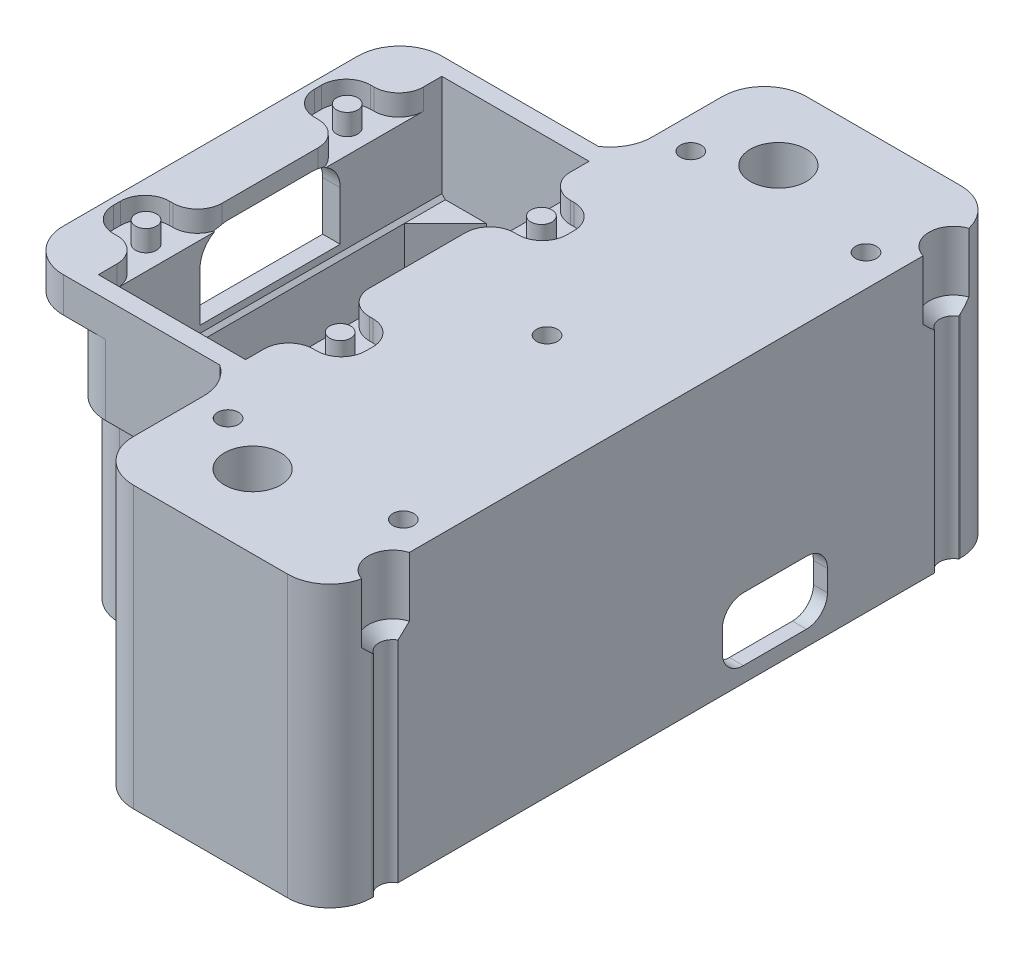
from build123d import *

# Parameters (mm, degrees)
SZKIC1_W                     = 24
SZKIC1_H                     = 52
DODANIE_WYCI_GNI_CIE1_DEPTH  = 25
SZKIC2_W                     = 26
SZKIC2_H                     = 54
SZKIC2_W_2                   = 21
SZKIC2_H_2                   = 49
DODANIE_WYCI_GNI_CIE2_DEPTH  = 12
SZKIC3_W                     = 38
SZKIC3_H                     = 54
SZKIC3_W_2                   = 21
SZKIC3_H_2                   = 49
DODANIE_WYCI_GNI_CIE3_DEPTH  = 2
SZKIC4_W                     = 38
SZKIC4_H                     = 54
DODANIE_WYCI_GNI_CIE4_DEPTH  = 3
ZAOKR_GLENIE1_R              = 3.5
SZKIC5_R                     = 1.5
DODANIE_WYCI_GNI_CIE9_DEPTH  = 3
WYTNIJ_WYCI_GNI_CIE2_REACH   = 63.425
SZKIC7_W                     = 20
SZKIC7_H                     = 11
SZKIC8_W                     = 34
SZKIC8_H                     = 96
SZKIC8_W_2                   = 30
SZKIC8_H_2                   = 92
DODANIE_WYCI_GNI_CIE5_DEPTH  = 18.5
SZKIC9_W                     = 34
SZKIC9_H                     = 96
DODANIE_WYCI_GNI_CIE6_DEPTH  = 3
SZKIC10_R                    = 1.9
WYTNIJ_WYCI_GNI_CIE3_DEPTH   = 70.873099259
ZAOKR_GLENIE2_R              = 4
SZKIC11_W                    = 34
SZKIC11_H                    = 96
SZKIC11_R                    = 4
DODANIE_WYCI_GNI_CIE7_DEPTH  = 3.5
SZKIC20_R                    = 4
DODANIE_WYCI_GNI_CIE10_DEPTH = 10
SZKIC21_R                    = 4
DODANIE_WYCI_GNI_CIE11_DEPTH = 5
SZKIC13_R                    = 1.5
WYTNIJ_WYCI_GNI_CIE4_DEPTH   = 6
WYTNIJ_WYCI_GNI_CIE5_DEPTH   = 72.028163428
SFAZOWANIE1_SIZE             = 0.5
SFAZOWANIE2_SIZE             = 2.1
ZAOKR_GLENIE3_R              = 6
ZAOKR_GLENIE4_R              = 4
SZKIC18_R                    = 3.5
WYTNIJ_WYCI_GNI_CIE8_DEPTH   = 10
SFAZOWANIE3_SIZE             = 1.5
SZKIC19_R                    = 2
WYTNIJ_WYCI_GNI_CIE9_DEPTH   = 73.938330286
WYTNIJ_WYCI_GNI_CIE10_REACH  = 92.161
SZKIC22_W                    = 15
SZKIC22_H                    = 9
ZAOKR_GLENIE5_R              = 3


with BuildPart() as part:
    # Szkic1 → Dodanie-wyciągnięcie1 (new body)
    with BuildSketch(Plane(origin=(0, 0, 0), x_dir=(1, 0, 0), z_dir=(0, 1, 0))):
        Rectangle(SZKIC1_W, SZKIC1_H)
        with BuildLine():
            Line((10, 14.5), (10, -14.5))
            ThreePointArc((10, -14.5), (0, -24.5), (-10, -14.5))
            Line((-10, -14.5), (-10, 14.5))
            ThreePointArc((-10, 14.5), (0, 24.5), (10, 14.5))
        make_face(mode=Mode.SUBTRACT)
    extrude(amount=DODANIE_WYCI_GNI_CIE1_DEPTH)

    # Szkic2 → Dodanie-wyciągnięcie2 (add)
    with BuildSketch(Plane(origin=(0, 25, 0), x_dir=(1, 0, 0), z_dir=(0, 1, 0))):
        Rectangle(SZKIC2_W, SZKIC2_H)
        Rectangle(SZKIC2_W_2, SZKIC2_H_2, mode=Mode.SUBTRACT)
    extrude(amount=DODANIE_WYCI_GNI_CIE2_DEPTH)

    # Szkic3 → Dodanie-wyciągnięcie3 (add)
    with BuildSketch(Plane(origin=(0, 37, 0), x_dir=(1, 0, 0), z_dir=(0, 1, 0))):
        Rectangle(SZKIC3_W, SZKIC3_H)
        Rectangle(SZKIC3_W_2, SZKIC3_H_2, mode=Mode.SUBTRACT)
    extrude(amount=-DODANIE_WYCI_GNI_CIE3_DEPTH)

    # Szkic4 → Dodanie-wyciągnięcie4 (add)
    with BuildSketch(Plane(origin=(0, 37, 0), x_dir=(1, 0, 0), z_dir=(0, 1, 0))):
        Rectangle(SZKIC4_W, SZKIC4_H)
        Polygon((-10, 24.5), (10, 24.5), (10.5, 24.5), (10.5, 18.35), (18, 18.35), (18, 10.35), (10.5, 10.35), (10.5, -10.35), (18, -10.35), (18, -18.35), (10.5, -18.35), (10.5, -24.5), (10, -24.5), (-10, -24.5), (-10.5, -24.5), (-10.5, -18.35), (-18, -18.35), (-18, -10.35), (-10.5, -10.35), (-10.5, 10.35), (-18, 10.35), (-18, 18.35), (-10.5, 18.35), (-10.5, 24.5), align=None, mode=Mode.SUBTRACT)
    extrude(amount=DODANIE_WYCI_GNI_CIE4_DEPTH)

    # Zaokrąglenie1
    zaokr_glenie1_edges = [part.edges().sort_by_distance(p)[0] for p in [
        (10.5, 38.5, -18.35),
        (18, 38.5, -18.35),
        (18, 38.5, -10.35),
        (10.5, 38.5, -10.35),
        (10.5, 38.5, 10.35),
        (18, 38.5, 10.35),
        (18, 38.5, 18.35),
        (10.5, 38.5, 18.35),
        (-10.5, 38.5, 18.35),
        (-18, 38.5, 18.35),
        (-18, 38.5, 10.35),
        (-10.5, 38.5, 10.35),
        (-10.5, 38.5, -10.35),
        (-18, 38.5, -10.35),
        (-18, 38.5, -18.35),
        (-10.5, 38.5, -18.35),
    ]]
    fillet(zaokr_glenie1_edges, radius=ZAOKR_GLENIE1_R)

    # Szkic5 → Dodanie-wyciągnięcie9 (add)
    with BuildSketch(Plane(origin=(0, 37, 0), x_dir=(1, 0, 0), z_dir=(0, 1, 0))):
        with Locations(Location((13.85, -14.35, 0), (0, 0, 270))):
            Circle(SZKIC5_R)
        with Locations(Location((13.85, 14.35, 0), (0, 0, 270))):
            Circle(SZKIC5_R)
        with Locations(Location((-13.85, -14.35, 0), (0, 0, 90))):
            Circle(SZKIC5_R)
        with Locations(Location((-13.85, 14.35, 0), (0, 0, 90))):
            Circle(SZKIC5_R)
    extrude(amount=DODANIE_WYCI_GNI_CIE9_DEPTH)

    # Szkic7 → Wytnij-wyciągnięcie2 (cut, up to next)
    with BuildSketch(Plane.ZY.offset(19), mode=Mode.PRIVATE) as wytnij_wyci_gni_cie2_sk1:
        with Locations((0, 32)):
            Rectangle(SZKIC7_W, SZKIC7_H)
    wytnij_wyci_gni_cie2_tool1 = extrude(wytnij_wyci_gni_cie2_sk1.sketch, amount=-WYTNIJ_WYCI_GNI_CIE2_REACH, mode=Mode.PRIVATE) & part.part
    add(wytnij_wyci_gni_cie2_tool1.solids().sort_by_distance((-19, 32, 0))[0], mode=Mode.SUBTRACT)

    # Szkic8 → Dodanie-wyciągnięcie5 (add)
    with BuildSketch(Plane(origin=(0, 0, 0), x_dir=(1, 0, 0), z_dir=(0, 1, 0))):
        with Locations((29, 0)):
            Rectangle(SZKIC8_W, SZKIC8_H)
        with Locations((29, 0)):
            Rectangle(SZKIC8_W_2, SZKIC8_H_2, mode=Mode.SUBTRACT)
    extrude(amount=DODANIE_WYCI_GNI_CIE5_DEPTH)

    # Szkic9 → Dodanie-wyciągnięcie6 (add)
    with BuildSketch(Plane(origin=(0, 18.5, 0), x_dir=(1, 0, 0), z_dir=(0, 1, 0))):
        with Locations((29, 0)):
            Rectangle(SZKIC9_W, SZKIC9_H)
    extrude(amount=DODANIE_WYCI_GNI_CIE6_DEPTH)

    # Szkic10 → Wytnij-wyciągnięcie3 (cut, through all)
    with BuildSketch(Plane(origin=(0, 21.5, 0), x_dir=(1, 0, 0), z_dir=(0, 1, 0))):
        with Locations(Location((24.5, 37.5, 0), (0, 0, 270))):
            Circle(SZKIC10_R)
        with Locations(Location((24.5, -37.5, 0), (0, 0, 270))):
            Circle(SZKIC10_R)
    extrude(amount=-WYTNIJ_WYCI_GNI_CIE3_DEPTH, mode=Mode.SUBTRACT)

    # Zaokrąglenie2
    zaokr_glenie2_edges = [part.edges().sort_by_distance(p)[0] for p in [
        (44, 9.25, -46),
        (14, 9.25, -46),
        (14, 9.25, 46),
        (44, 9.25, 46),
    ]]
    fillet(zaokr_glenie2_edges, radius=ZAOKR_GLENIE2_R)

    # Szkic11 → Dodanie-wyciągnięcie7 (add)
    with BuildSketch(Plane(origin=(0, 21.5, 0), x_dir=(1, 0, 0), z_dir=(0, 1, 0))):
        with Locations((29, 0)):
            Rectangle(SZKIC11_W, SZKIC11_H)
        with Locations(Location((24.5, 37.5, 0), (0, 0, 90))):
            Circle(SZKIC11_R, mode=Mode.SUBTRACT)
        with Locations(Location((24.5, -37.5, 0), (0, 0, 90))):
            Circle(SZKIC11_R, mode=Mode.SUBTRACT)
    extrude(amount=DODANIE_WYCI_GNI_CIE7_DEPTH)

    # Szkic20 → Dodanie-wyciągnięcie10 (add)
    with BuildSketch(Plane(origin=(0, 25, 0), x_dir=(1, 0, 0), z_dir=(0, 1, 0))):
        Polygon((12, 27), (13, 27), (13, -27), (12, -27), (12, -48), (46, -48), (46, 48), (12, 48), align=None)
        with Locations(Location((24.5, 37.5, 0), (0, 0, 90))):
            Circle(SZKIC20_R, mode=Mode.SUBTRACT)
        with Locations(Location((24.5, -37.5, 0), (0, 0, 90))):
            Circle(SZKIC20_R, mode=Mode.SUBTRACT)
    extrude(amount=DODANIE_WYCI_GNI_CIE10_DEPTH)

    # Szkic21 → Dodanie-wyciągnięcie11 (add)
    with BuildSketch(Plane(origin=(0, 35, 0), x_dir=(1, 0, 0), z_dir=(0, 1, 0))):
        Polygon((12, 27), (19, 27), (19, -27), (12, -27), (12, -48), (46, -48), (46, 48), (12, 48), align=None)
        with Locations(Location((24.5, 37.5, 0), (0, 0, 90))):
            Circle(SZKIC21_R, mode=Mode.SUBTRACT)
        with Locations(Location((24.5, -37.5, 0), (0, 0, 90))):
            Circle(SZKIC21_R, mode=Mode.SUBTRACT)
    extrude(amount=DODANIE_WYCI_GNI_CIE11_DEPTH)

    # Szkic13 → Wytnij-wyciągnięcie4 (cut)
    with BuildSketch(Plane(origin=(0, 40, 0), x_dir=(1, 0, 0), z_dir=(0, 1, 0))):
        with Locations(Location((41.5, 33, 0), (0, 0, 270))):
            Circle(SZKIC13_R)
        with Locations(Location((41.5, -33, 0), (0, 0, 270))):
            Circle(SZKIC13_R)
        with Locations(Location((16.5, -33, 0), (0, 0, 90))):
            Circle(SZKIC13_R)
        with Locations(Location((16.5, 33, 0), (0, 0, 90))):
            Circle(SZKIC13_R)
        with Locations(Location((29, 0, 0), (0, 0, 270))):
            Circle(SZKIC13_R)
    extrude(amount=-WYTNIJ_WYCI_GNI_CIE4_DEPTH, mode=Mode.SUBTRACT)

    # Szkic14 → Wytnij-wyciągnięcie5 (cut, through all)
    with BuildSketch(Plane(origin=(0, 25, 0), x_dir=(1, 0, 0), z_dir=(0, 1, 0))):
        Polygon((10, 0), (10, 18.642135624), (4.142135624, 24.5), (-4.142135624, 24.5), (-10, 18.642135624), (-10, 0), (-10, -18.642135624), (-4.142135624, -24.5), (4.142135624, -24.5), (10, -18.642135624), align=None)
    extrude(amount=-WYTNIJ_WYCI_GNI_CIE5_DEPTH, mode=Mode.SUBTRACT)

    # Sfazowanie1
    sfazowanie1_edges = [part.edges().sort_by_distance(p)[0] for p in [
        (10.5, 25, 0),
        (-10.5, 25, 0),
    ]]
    chamfer(sfazowanie1_edges, length=SFAZOWANIE1_SIZE - 0.0001)  # a hair under: the kernel refuses the full size

    # Sfazowanie2
    sfazowanie2_edges = [part.edges().sort_by_distance(p)[0] for p in [
        (24.5, 21.5, -33.5),
        (24.5, 21.5, 41.5),
    ]]
    chamfer(sfazowanie2_edges, length=SFAZOWANIE2_SIZE - 0.0001)  # a hair under: the kernel refuses the full size

    # Zaokrąglenie3
    zaokr_glenie3_edges = [part.edges().sort_by_distance(p)[0] for p in [
        (12, 12.5, 26),
        (12, 12.5, -26),
        (-19, 37.5, 27),
        (-19, 37.5, -27),
        (-12, 12.5, -26),
        (-12, 12.5, 26),
        (12, 20, -48),
        (46, 20, -48),
        (46, 20, 48),
        (12, 20, 48),
        (-13, 30, -27),
        (-13, 30, 27),
    ]]
    fillet(zaokr_glenie3_edges, radius=ZAOKR_GLENIE3_R)

    # Zaokrąglenie4
    zaokr_glenie4_edges = [part.edges().sort_by_distance(p)[0] for p in [
        (-15.737192685, 37.5, 10),
        (-15.737192685, 37.5, -10),
    ]]
    fillet(zaokr_glenie4_edges, radius=ZAOKR_GLENIE4_R)

    # Szkic18 → Wytnij-wyciągnięcie8 (cut)
    with BuildSketch(Plane(origin=(0, 40, 0), x_dir=(1, 0, 0), z_dir=(0, 1, 0))):
        with Locations((47, 40)):
            Circle(SZKIC18_R)
        with Locations((47, -40)):
            Circle(SZKIC18_R)
    extrude(amount=-WYTNIJ_WYCI_GNI_CIE8_DEPTH, mode=Mode.SUBTRACT)

    # Sfazowanie3
    sfazowanie3_edges = [part.edges().sort_by_distance(p)[0] for p in [
        (43.500820064, 30, -39.924238715),
        (43.500820064, 30, 39.924238715),
    ]]
    chamfer(sfazowanie3_edges, length=SFAZOWANIE3_SIZE)

    # Szkic19 → Wytnij-wyciągnięcie9 (cut, through all)
    with BuildSketch(Plane(origin=(0, 30, 0), x_dir=(1, 0, 0), z_dir=(0, 1, 0))):
        with Locations((47, -40)):
            Circle(SZKIC19_R)
        with Locations((47, 40)):
            Circle(SZKIC19_R)
    extrude(amount=-WYTNIJ_WYCI_GNI_CIE9_DEPTH, mode=Mode.SUBTRACT)

    # Szkic22 → Wytnij-wyciągnięcie10 (cut, up to next)
    with BuildSketch(Plane(origin=(46, 0, 0), x_dir=(0, 0, -1), z_dir=(1, 0, 0)), mode=Mode.PRIVATE) as wytnij_wyci_gni_cie10_sk1:
        with Locations((15.5, 6.7)):
            Rectangle(SZKIC22_W, SZKIC22_H)
    wytnij_wyci_gni_cie10_tool1 = extrude(wytnij_wyci_gni_cie10_sk1.sketch, amount=-WYTNIJ_WYCI_GNI_CIE10_REACH, mode=Mode.PRIVATE) & part.part
    add(wytnij_wyci_gni_cie10_tool1.solids().sort_by_distance((46, 6.7, -15.5))[0], mode=Mode.SUBTRACT)

    # Zaokrąglenie5
    zaokr_glenie5_edges = [part.edges().sort_by_distance(p)[0] for p in [
        (45, 2.2, -8),
        (45, 11.2, -8),
        (45, 11.2, -23),
        (45, 2.2, -23),
    ]]
    fillet(zaokr_glenie5_edges, radius=ZAOKR_GLENIE5_R)


solid = part.part
